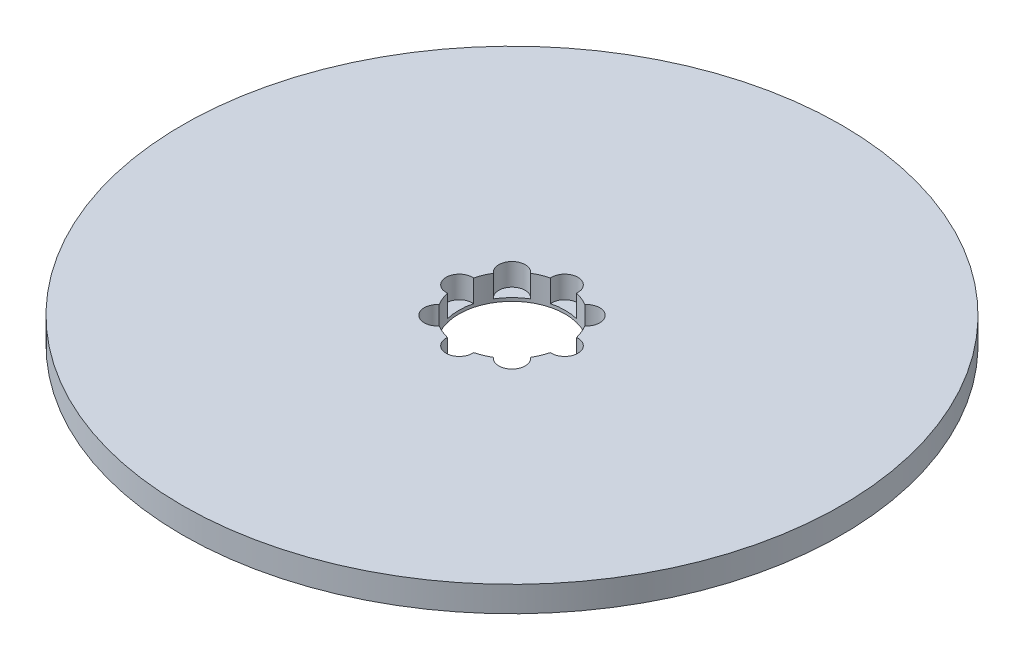
from build123d import *

# Parameters (mm, degrees)
SKETCH1_R           = 77.5
BOSS_EXTRUDE1_DEPTH = 6
SKETCH2_R           = 12.5
CUT_EXTRUDE1_DEPTH  = 110.765659475
SKETCH3_R           = 3.099503232
CUT_EXTRUDE2_DEPTH  = 5.228379038
CIRPATTERN1_COUNT   = 8


with BuildPart() as part:
    # Sketch1 → Boss-Extrude1 (new body)
    with BuildSketch(Plane(origin=(0, 0, 0), x_dir=(1, 0, 0), z_dir=(0, 1, 0))):
        Circle(SKETCH1_R)
    extrude(amount=BOSS_EXTRUDE1_DEPTH)

    # Sketch2 → Cut-Extrude1 (cut, through all)
    with BuildSketch(Plane(origin=(0, 0, 0), x_dir=(1, 0, 0), z_dir=(0, 1, 0))):
        Circle(SKETCH2_R)
    extrude(amount=CUT_EXTRUDE1_DEPTH, mode=Mode.SUBTRACT)

    # Sketch3 → Cut-Extrude2 (cut)
    with BuildSketch(Plane(origin=(0, 6, 0), x_dir=(1, 0, 0), z_dir=(0, 1, 0))):
        with Locations((-12.391135016, 0)):
            Circle(SKETCH3_R)
    cut_extrude2 = extrude(amount=-CUT_EXTRUDE2_DEPTH, mode=Mode.SUBTRACT)

    # CirPattern1: Cut-Extrude2 ×8 about axis
    cirpattern1_axis = Axis((0, 0, 0), (0, 1, 0))
    for i in range(1, CIRPATTERN1_COUNT):
        add(cut_extrude2.rotate(cirpattern1_axis, i * 360 / CIRPATTERN1_COUNT), mode=Mode.SUBTRACT)


solid = part.part
